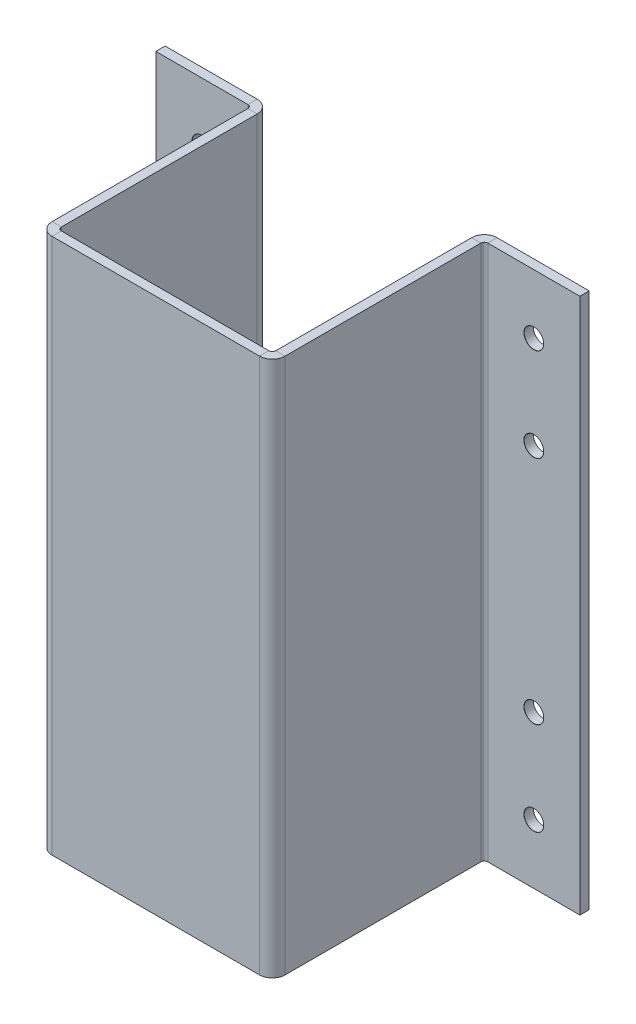
from build123d import *

# Parameters (mm, degrees)
SKETCH1_W                        = 45
SKETCH1_H                        = 115
BASE_FLANGE1_DEPTH               = 2
EDGE_FLANGE1_STRIP_W             = 9.9732
EDGE_FLANGE1_STRIP_H             = 2
EDGE_FLANGE1_STRIP_CUT_DEPTH     = 115
EDGE_FLANGE1_DEPTH               = 115
EDGE_FLANGE2_STRIP_W             = 9.9732
EDGE_FLANGE2_STRIP_H             = 2
EDGE_FLANGE2_STRIP_CUT_DEPTH     = 115
EDGE_FLANGE2_DEPTH               = 115
EDGE_FLANGE3_STRIP_W             = 9.9732
EDGE_FLANGE3_STRIP_H             = 2
EDGE_FLANGE3_STRIP_CUT_DEPTH     = 115
EDGE_FLANGE3_DEPTH               = 115
EDGE_FLANGE4_STRIP_W             = 9.9732
EDGE_FLANGE4_STRIP_H             = 2
EDGE_FLANGE4_STRIP_CUT_DEPTH     = 115
EDGE_FLANGE4_DEPTH               = 115
TAP_DRILL_FOR_M5_TAP1_AT_2_COUNT = 2
TAP_DRILL_FOR_M5_TAP1_AT_2_PITCH = 20
TAP_DRILL_FOR_M5_TAP1_AT_3_COUNT = 2
TAP_DRILL_FOR_M5_TAP1_AT_3_PITCH = 69.48
TAP_DRILL_FOR_M5_TAP1_AT_4_COUNT = 2
TAP_DRILL_FOR_M5_TAP1_AT_4_PITCH = 89.48
TAP_DRILL_FOR_M5_TAP1_AT_5_COUNT = 2
TAP_DRILL_FOR_M5_TAP1_AT_5_PITCH = 114.373614001
TAP_DRILL_FOR_M5_TAP1_AT_6_COUNT = 2
TAP_DRILL_FOR_M5_TAP1_AT_6_PITCH = 99.509414527
TAP_DRILL_FOR_M5_TAP1_AT_7_COUNT = 2
TAP_DRILL_FOR_M5_TAP1_AT_7_PITCH = 73.990899302
TAP_DRILL_FOR_M5_TAP1_AT_8_COUNT = 2
TAP_DRILL_FOR_M5_TAP1_AT_8_PITCH = 71.2366


# Sheet-metal steps are written as plain solids
with BuildPart() as part:
    # Sketch1 → Base-Flange1 (new body)
    with BuildSketch(Plane.XY):
        Rectangle(SKETCH1_W, SKETCH1_H)
    extrude(amount=-BASE_FLANGE1_DEPTH)

    # Edge-Flange1 strip (across the edge) → Edge-Flange1 strip cut (cut)
    with BuildSketch(Plane(origin=(23, 57.5, -2), x_dir=(-1, 0, 0), z_dir=(0, -1, 0))):
        with Locations((-4.25, -1)):
            Rectangle(EDGE_FLANGE1_STRIP_W, EDGE_FLANGE1_STRIP_H)
    extrude(amount=EDGE_FLANGE1_STRIP_CUT_DEPTH, mode=Mode.SUBTRACT)

    # Edge-Flange1 section (across the edge) → Edge-Flange1 (add)
    with BuildSketch(Plane(origin=(23, 57.5, -2), x_dir=(-1, 0, 0), z_dir=(0, -1, 0))):
        with BuildLine():
            Line((-2, 0.7366), (-2, 43))
            Line((-2, 43), (0, 43))
            Line((0, 43), (0, 0.7366))
            ThreePointArc((0, 0.7366), (0.215745145, 0.215745145), (0.7366, 0))
            Line((0.7366, 0), (0.7366, -2))
            ThreePointArc((0.7366, -2), (-1.198468417, -1.198468417), (-2, 0.7366))
        make_face()
    extrude(amount=EDGE_FLANGE1_DEPTH)

    # Edge-Flange2 strip (across the edge) → Edge-Flange2 strip cut (cut)
    with BuildSketch(Plane(origin=(25, -57.5, -45.5), x_dir=(0, 0, 1), z_dir=(0, 1, 0))):
        with Locations((-4.25, -1)):
            Rectangle(EDGE_FLANGE2_STRIP_W, EDGE_FLANGE2_STRIP_H)
    extrude(amount=EDGE_FLANGE2_STRIP_CUT_DEPTH, mode=Mode.SUBTRACT)

    # Edge-Flange2 section (across the edge) → Edge-Flange2 (add)
    with BuildSketch(Plane(origin=(25, -57.5, -45.5), x_dir=(0, 0, 1), z_dir=(0, 1, 0))):
        with BuildLine():
            Line((-2, 0.7366), (-2, 20.5))
            Line((-2, 20.5), (0, 20.5))
            Line((0, 20.5), (0, 0.7366))
            ThreePointArc((0, 0.7366), (0.215745145, 0.215745145), (0.7366, 0))
            Line((0.7366, 0), (0.7366, -2))
            ThreePointArc((0.7366, -2), (-1.198468417, -1.198468417), (-2, 0.7366))
        make_face()
    extrude(amount=EDGE_FLANGE2_DEPTH)

    # Edge-Flange3 strip (across the edge) → Edge-Flange3 strip cut (cut)
    with BuildSketch(Plane(origin=(-23, -57.5, -2), x_dir=(1, 0, 0), z_dir=(0, 1, 0))):
        with Locations((-4.25, -1)):
            Rectangle(EDGE_FLANGE3_STRIP_W, EDGE_FLANGE3_STRIP_H)
    extrude(amount=EDGE_FLANGE3_STRIP_CUT_DEPTH, mode=Mode.SUBTRACT)

    # Edge-Flange3 section (across the edge) → Edge-Flange3 (add)
    with BuildSketch(Plane(origin=(-23, -57.5, -2), x_dir=(1, 0, 0), z_dir=(0, 1, 0))):
        with BuildLine():
            Line((-2, 0.7366), (-2, 43))
            Line((-2, 43), (0, 43))
            Line((0, 43), (0, 0.7366))
            ThreePointArc((0, 0.7366), (0.215745145, 0.215745145), (0.7366, 0))
            Line((0.7366, 0), (0.7366, -2))
            ThreePointArc((0.7366, -2), (-1.198468417, -1.198468417), (-2, 0.7366))
        make_face()
    extrude(amount=EDGE_FLANGE3_DEPTH)

    # Edge-Flange4 strip (across the edge) → Edge-Flange4 strip cut (cut)
    with BuildSketch(Plane(origin=(-25, 57.5, -45.5), x_dir=(0, 0, 1), z_dir=(0, -1, 0))):
        with Locations((-4.25, -1)):
            Rectangle(EDGE_FLANGE4_STRIP_W, EDGE_FLANGE4_STRIP_H)
    extrude(amount=EDGE_FLANGE4_STRIP_CUT_DEPTH, mode=Mode.SUBTRACT)

    # Edge-Flange4 section (across the edge) → Edge-Flange4 (add)
    with BuildSketch(Plane(origin=(-25, 57.5, -45.5), x_dir=(0, 0, 1), z_dir=(0, -1, 0))):
        with BuildLine():
            Line((-2, 0.7366), (-2, 20.5))
            Line((-2, 20.5), (0, 20.5))
            Line((0, 20.5), (0, 0.7366))
            ThreePointArc((0, 0.7366), (0.215745145, 0.215745145), (0.7366, 0))
            Line((0.7366, 0), (0.7366, -2))
            ThreePointArc((0.7366, -2), (-1.198468417, -1.198468417), (-2, 0.7366))
        make_face()
    extrude(amount=EDGE_FLANGE4_DEPTH)

    # Sketch21 → Tap Drill for M5 Tap1 (revolve, cut)
    with BuildSketch(Plane(origin=(-35.6183, 44.74, -45.5), x_dir=(0, -1, 0), z_dir=(1, 0, 0))):
        Polygon((0, 0), (0, 2), (2.1, 2), (2.1, 0.025), (2.125, 0), align=None)
    tap_drill_for_m5_tap1 = revolve(axis=Axis((-35.6183, 44.74, -39.15), (0, 0, -1)), mode=Mode.SUBTRACT)

    # Tap Drill for M5 Tap1 at 2: Tap Drill for M5 Tap1 ×2
    with Locations(*[(0, -i * TAP_DRILL_FOR_M5_TAP1_AT_2_PITCH, 0) for i in range(1, TAP_DRILL_FOR_M5_TAP1_AT_2_COUNT)]):
        add(tap_drill_for_m5_tap1, mode=Mode.SUBTRACT)

    # Tap Drill for M5 Tap1 at 3: Tap Drill for M5 Tap1 ×2
    with Locations(*[(0, -i * TAP_DRILL_FOR_M5_TAP1_AT_3_PITCH, 0) for i in range(1, TAP_DRILL_FOR_M5_TAP1_AT_3_COUNT)]):
        add(tap_drill_for_m5_tap1, mode=Mode.SUBTRACT)

    # Tap Drill for M5 Tap1 at 4: Tap Drill for M5 Tap1 ×2
    with Locations(*[(0, -i * TAP_DRILL_FOR_M5_TAP1_AT_4_PITCH, 0) for i in range(1, TAP_DRILL_FOR_M5_TAP1_AT_4_COUNT)]):
        add(tap_drill_for_m5_tap1, mode=Mode.SUBTRACT)

    # Tap Drill for M5 Tap1 at 5: Tap Drill for M5 Tap1 ×2
    with Locations(*[Vector(0.622841208809067, -0.7823482783321378, 0) * (i * TAP_DRILL_FOR_M5_TAP1_AT_5_PITCH) for i in range(1, TAP_DRILL_FOR_M5_TAP1_AT_5_COUNT)]):
        add(tap_drill_for_m5_tap1, mode=Mode.SUBTRACT)

    # Tap Drill for M5 Tap1 at 6: Tap Drill for M5 Tap1 ×2
    with Locations(*[Vector(0.7158779934382821, -0.6982253923417416, 0) * (i * TAP_DRILL_FOR_M5_TAP1_AT_6_PITCH) for i in range(1, TAP_DRILL_FOR_M5_TAP1_AT_6_COUNT)]):
        add(tap_drill_for_m5_tap1, mode=Mode.SUBTRACT)

    # Tap Drill for M5 Tap1 at 7: Tap Drill for M5 Tap1 ×2
    with Locations(*[Vector(0.9627751611583101, -0.27030351284544973, 0) * (i * TAP_DRILL_FOR_M5_TAP1_AT_7_PITCH) for i in range(1, TAP_DRILL_FOR_M5_TAP1_AT_7_COUNT)]):
        add(tap_drill_for_m5_tap1, mode=Mode.SUBTRACT)

    # Tap Drill for M5 Tap1 at 8: Tap Drill for M5 Tap1 ×2
    with Locations(*[(i * TAP_DRILL_FOR_M5_TAP1_AT_8_PITCH, 0, 0) for i in range(1, TAP_DRILL_FOR_M5_TAP1_AT_8_COUNT)]):
        add(tap_drill_for_m5_tap1, mode=Mode.SUBTRACT)


solid = part.part
